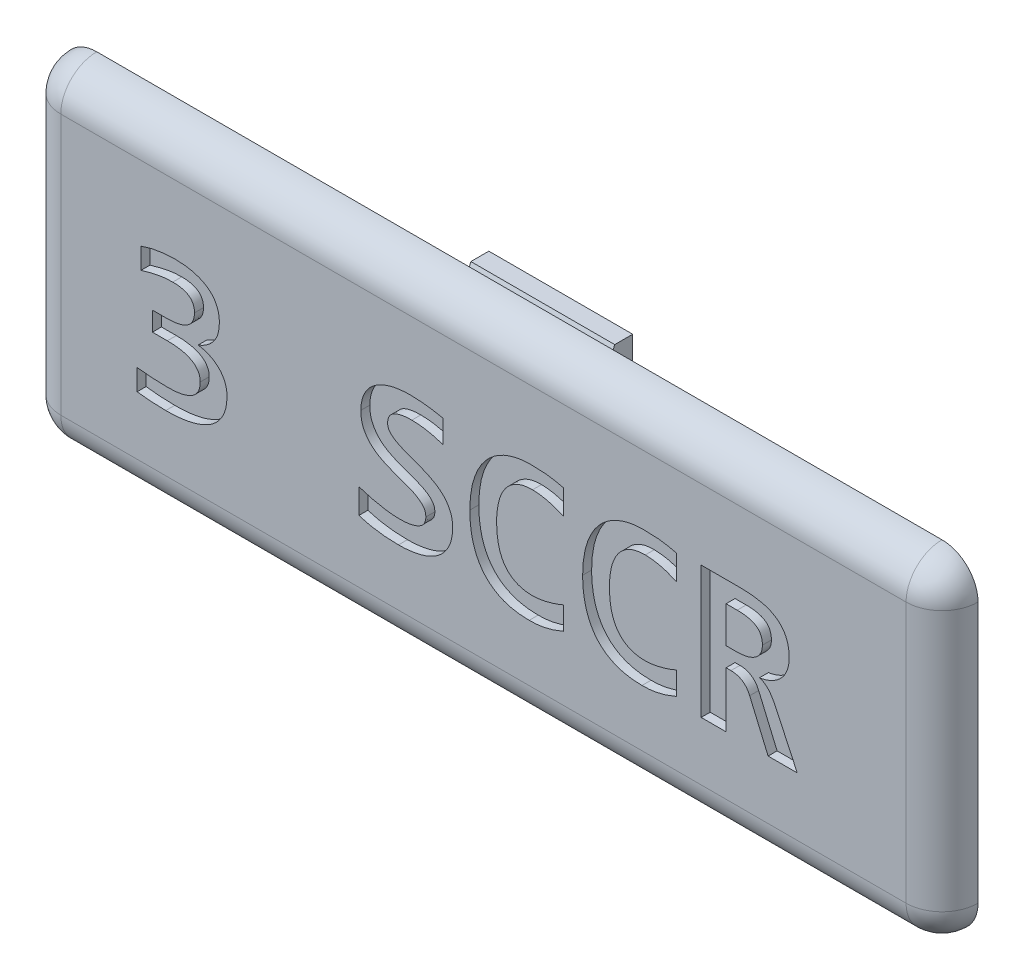
from build123d import *

# Parameters (mm, degrees)
BOSS_EXTRUDE1_DEPTH = 2
SKETCH3_W           = 47.5
SKETCH3_H           = 15
BOSS_EXTRUDE2_DEPTH = 1
SKETCH4_W           = 9.5
SKETCH4_H           = 5
CUT_EXTRUDE1_DEPTH  = 1
SKETCH5_W           = 8
SKETCH5_H           = 8.5
CUT_EXTRUDE2_DEPTH  = 1
SKETCH6_W           = 4
SKETCH6_H           = 1.75
BOSS_EXTRUDE3_DEPTH = 1.75
BOSS_EXTRUDE4_DEPTH = 4
FILLET1_R           = 2
CUT_EXTRUDE3_DEPTH  = 0.5


with BuildPart() as part:
    # Sketch1 → Boss-Extrude1 (new body)
    with BuildSketch(Plane.XY):
        with BuildLine():
            Line((25.5, -7.25), (25.5, 7.25))
            ThreePointArc((25.5, 7.25), (24.914213562, 8.664213562), (23.5, 9.25))
            Line((23.5, 9.25), (-23.5, 9.25))
            ThreePointArc((-23.5, 9.25), (-24.914213562, 8.664213562), (-25.5, 7.25))
            Line((-25.5, 7.25), (-25.5, -7.25))
            ThreePointArc((-25.5, -7.25), (-24.914213562, -8.664213562), (-23.5, -9.25))
            Line((-23.5, -9.25), (23.5, -9.25))
            ThreePointArc((23.5, -9.25), (24.914213562, -8.664213562), (25.5, -7.25))
        make_face()
    extrude(amount=BOSS_EXTRUDE1_DEPTH)

    # Sketch3 → Boss-Extrude2 (add)
    with BuildSketch(Plane(origin=(0, 0, 0), x_dir=(-1, 0, 0), z_dir=(0, 0, -1))):
        Rectangle(SKETCH3_W, SKETCH3_H)
    extrude(amount=BOSS_EXTRUDE2_DEPTH)

    # Sketch4 → Cut-Extrude1 (cut)
    with BuildSketch(Plane(origin=(0, 0, -1), x_dir=(-1, 0, 0), z_dir=(0, 0, -1))):
        with Locations((-13.5, -5)):
            Rectangle(SKETCH4_W, SKETCH4_H)
    extrude(amount=-CUT_EXTRUDE1_DEPTH, mode=Mode.SUBTRACT)

    # Sketch5 → Cut-Extrude2 (cut)
    with BuildSketch(Plane(origin=(0, 0, -1), x_dir=(-1, 0, 0), z_dir=(0, 0, -1))):
        with Locations((-17, 3.5)):
            Rectangle(SKETCH5_W, SKETCH5_H)
    extrude(amount=-CUT_EXTRUDE2_DEPTH, mode=Mode.SUBTRACT)

    # Sketch6 → Boss-Extrude3 (add)
    with BuildSketch(Plane(origin=(0, 0, 0), x_dir=(-1, 0, 0), z_dir=(0, 0, -1))):
        with Locations((-13.5, -8.375)):
            Rectangle(SKETCH6_W, SKETCH6_H)
    extrude(amount=BOSS_EXTRUDE3_DEPTH)

    # Sketch8 → Boss-Extrude4 (add, symmetric)
    with BuildSketch(Plane(origin=(0, 0, 0), x_dir=(0, 0, -1), z_dir=(1, 0, 0))):
        Polygon((2.3, 6.05), (2.3, 8.25), (1.3, 8.25), (1, 7.5), (1, 5.25), align=None)
    boss_extrude4 = extrude(amount=BOSS_EXTRUDE4_DEPTH, both=True)

    # Mirror1: Boss-Extrude4 across plane
    add(boss_extrude4.mirror(Plane.ZX))

    # Fillet1
    fillet1_edges = [part.edges().sort_by_distance(p)[0] for p in [
        (-24.914213562, 8.664213562, 2),
        (0, 9.25, 2),
        (24.914213562, 8.664213562, 2),
        (25.5, 0, 2),
        (24.914213562, -8.664213562, 2),
        (0, -9.25, 2),
        (-24.914213562, -8.664213562, 2),
        (-25.5, 0, 2),
    ]]
    fillet(fillet1_edges, radius=FILLET1_R - 0.0001)  # a hair under: the kernel refuses the full size

    # Sketch9 → Cut-Extrude3 (cut)
    # profile 1 of 5: a face of its own
    with BuildSketch(Plane.XY.offset(2)):
        with BuildLine():
            add(Edge.make_bspline(
                [(-14.258793308, -1.734083933), (-14.261338893, -1.823383609), (-14.266327739, -1.998393475), (-14.305698368, -2.25394343), (-14.367829681, -2.496289664), (-14.458272629, -2.724000008), (-14.574973019, -2.936439813), (-14.719678085, -3.132982857), (-14.891993388, -3.312795027), (-15.09094383, -3.476300858), (-15.317316464, -3.621669421), (-15.571568157, -3.746944082), (-15.852002593, -3.857030086), (-16.159955894, -3.947723529), (-16.495450504, -4.018804737), (-16.85903025, -4.069328029), (-17.251191763, -4.101550311), (-17.522487334, -4.104694309), (-17.662651095, -4.106318642)],
                knots=[0, 0, 0, 0, 0.912858116, 1.789023019, 2.637878569, 3.466527431, 4.287731762, 5.110028795, 5.955173898, 6.828167036, 7.737664031, 8.700030571, 9.722187227, 10.815149218, 11.979155375, 13.226095558, 14.56687347, 16, 16, 16, 16], degree=3))
            add(Edge.make_bspline(
                [(-17.662651095, -4.106318642), (-17.728552119, -4.106106072), (-17.863709896, -4.105670108), (-18.069167207, -4.098459142), (-18.278995596, -4.088109784), (-18.488413845, -4.077387031), (-18.694888198, -4.061628202), (-18.893811258, -4.045969345), (-19.080754001, -4.027306556), (-19.199353248, -4.008802269), (-19.255769503, -4)],
                knots=[0, 0, 0, 0, 0.98977331, 2.029946609, 3.087400155, 4.145278822, 5.179315745, 6.197408451, 7.142528593, 8, 8, 8, 8], degree=3))
            Line((-19.255769503, -4), (-19.255769503, -2.830494933))
            add(Edge.make_bspline(
                [(-19.255769503, -2.830494933), (-19.130135895, -2.844969323), (-18.864841823, -2.875534153), (-18.448360506, -2.910154596), (-18.001204384, -2.931420699), (-17.694237415, -2.93499503), (-17.538058936, -2.936813576)],
                knots=[0, 0, 0, 0, 0.881238994, 1.860867368, 2.911653319, 4, 4, 4, 4], degree=3))
            add(Edge.make_bspline(
                [(-17.538058936, -2.936813576), (-17.462713414, -2.936001075), (-17.317401653, -2.934434081), (-17.107962404, -2.918480834), (-16.914456114, -2.89726473), (-16.737354578, -2.860823198), (-16.574423102, -2.819674898), (-16.427616645, -2.764773178), (-16.293722073, -2.706956773), (-16.175854778, -2.635929602), (-16.073009548, -2.556405953), (-15.983156988, -2.468871223), (-15.907516922, -2.372843473), (-15.84985443, -2.265755706), (-15.802219469, -2.153234027), (-15.771726618, -2.031571755), (-15.750825675, -1.904253033), (-15.748455611, -1.81668007), (-15.747254303, -1.772292195)],
                knots=[0, 0, 0, 0, 1.495058618, 2.883377717, 4.167516066, 5.355141025, 6.469461815, 7.498576906, 8.462730458, 9.359913735, 10.221662372, 11.037695279, 11.844498768, 12.636570746, 13.444795257, 14.263193053, 15.119669287, 16, 16, 16, 16], degree=3))
            add(Edge.make_bspline(
                [(-15.747254303, -1.772292195), (-15.748521714, -1.73289899), (-15.751019789, -1.655254771), (-15.771160692, -1.541113562), (-15.806313248, -1.432907933), (-15.854778537, -1.330608247), (-15.917022957, -1.235314035), (-15.99202848, -1.146150588), (-16.083429854, -1.066182151), (-16.188882129, -0.992952537), (-16.308600244, -0.926912568), (-16.443475503, -0.867803366), (-16.594047931, -0.819448653), (-16.759893249, -0.777456271), (-16.940920038, -0.745178208), (-17.138152139, -0.719295647), (-17.351855094, -0.707423753), (-17.499841856, -0.705246494), (-17.576267198, -0.704122084)],
                knots=[0, 0, 0, 0, 0.79719744, 1.571280462, 2.337038891, 3.094215274, 3.856024772, 4.635446918, 5.445390317, 6.306838918, 7.230180381, 8.209082667, 9.28323138, 10.427896051, 11.670224082, 13.003691142, 14.452605309, 16, 16, 16, 16], degree=3))
            Line((-17.576267198, -0.704122084), (-18.405220363, -0.704122084))
            Line((-18.405220363, -0.704122084), (-18.405220363, 0.35906434))
            Line((-18.405220363, 0.35906434), (-17.629426519, 0.35906434))
            add(Edge.make_bspline(
                [(-17.629426519, 0.35906434), (-17.55683698, 0.359705028), (-17.417540212, 0.360934486), (-17.218619488, 0.378860112), (-17.038269223, 0.401572984), (-16.877568096, 0.439206214), (-16.733398524, 0.483455606), (-16.606062681, 0.536879816), (-16.492503018, 0.594408261), (-16.395530458, 0.661780928), (-16.31148418, 0.734999634), (-16.240932279, 0.815344734), (-16.183901556, 0.902122176), (-16.126882849, 1.026052013), (-16.075630298, 1.190817292), (-16.069362116, 1.328233905), (-16.06621023, 1.397332332)],
                knots=[0, 0, 0, 0, 1.433789909, 2.751392296, 3.944481829, 5.022152935, 6.008459802, 6.920862344, 7.747986091, 8.518918421, 9.247697909, 9.945594126, 10.625414262, 11.291085687, 12.637852341, 14, 14, 14, 14], degree=3))
            add(Edge.make_bspline(
                [(-16.06621023, 1.397332332), (-16.06938206, 1.464724995), (-16.075452106, 1.593696778), (-16.130987146, 1.775229574), (-16.227256232, 1.929653537), (-16.337443936, 2.034583651), (-16.44152632, 2.103851658), (-16.531375424, 2.149343865), (-16.630765633, 2.186639405), (-16.740076529, 2.218725289), (-16.859606443, 2.242926192), (-16.989345443, 2.261515383), (-17.12925561, 2.270915135), (-17.225736326, 2.272157839), (-17.275584788, 2.272799904)],
                knots=[0, 0, 0, 0, 1.426007585, 2.729002435, 3.973101892, 5.243117734, 5.92019915, 6.618316047, 7.372490256, 8.167305632, 9.030498267, 9.955026394, 10.943428355, 12, 12, 12, 12], degree=3))
            add(Edge.make_bspline(
                [(-17.275584788, 2.272799904), (-17.422615064, 2.268967212), (-17.716518884, 2.261305915), (-18.155353483, 2.188768052), (-18.597751135, 2.086084968), (-18.892376544, 1.998605823), (-19.043132218, 1.953843976)],
                knots=[0, 0, 0, 0, 0.977921989, 1.954801514, 2.953500725, 4, 4, 4, 4], degree=3))
            Line((-19.043132218, 1.953843976), (-19.043132218, 3.123349043))
            add(Edge.make_bspline(
                [(-19.043132218, 3.123349043), (-18.960851984, 3.150658191), (-18.801677238, 3.203488943), (-18.563774197, 3.269155245), (-18.331267157, 3.322049004), (-18.099876362, 3.367572929), (-17.867168774, 3.402868419), (-17.63092575, 3.42584622), (-17.389810563, 3.439096806), (-17.226871855, 3.441226392), (-17.144347713, 3.442304971)],
                knots=[0, 0, 0, 0, 1.075346247, 2.080304799, 3.060132735, 4.03283104, 5.005311009, 5.978664027, 6.976246853, 8, 8, 8, 8], degree=3))
            add(Edge.make_bspline(
                [(-17.144347713, 3.442304971), (-17.046289385, 3.440652827), (-16.855977069, 3.437446335), (-16.580105814, 3.414445776), (-16.322848561, 3.37532172), (-16.084480329, 3.317998641), (-15.863586537, 3.249326378), (-15.660322405, 3.165981418), (-15.476369959, 3.068242562), (-15.309890796, 2.958232233), (-15.162780235, 2.834496369), (-15.033492344, 2.698503567), (-14.92642265, 2.546707518), (-14.838861988, 2.383453163), (-14.767605335, 2.210206722), (-14.720796824, 2.025542998), (-14.689321723, 1.831990145), (-14.685842204, 1.699252871), (-14.684067878, 1.631565592)],
                knots=[0, 0, 0, 0, 1.364469515, 2.64817236, 3.849188922, 4.981835705, 6.056593623, 7.065464157, 8.034128668, 8.950988563, 9.836987269, 10.703777712, 11.55477087, 12.413301389, 13.277587792, 14.154187413, 15.058756973, 16, 16, 16, 16], degree=3))
            add(Edge.make_bspline(
                [(-14.684067878, 1.631565592), (-14.684879263, 1.577801039), (-14.686455192, 1.473375719), (-14.702940769, 1.320442682), (-14.723975407, 1.174911104), (-14.760694342, 1.037819713), (-14.802244553, 0.908117448), (-14.857154141, 0.78701381), (-14.918795464, 0.672534743), (-15.018360905, 0.532359573), (-15.162206805, 0.371387678), (-15.367132869, 0.204259936), (-15.600704282, 0.057268361), (-15.7742726, -0.015496691), (-15.863540318, -0.0529204)],
                knots=[0, 0, 0, 0, 0.875870592, 1.701177886, 2.505390449, 3.26934707, 4.011398404, 4.722507864, 5.433445482, 6.126983947, 7.520330249, 8.937068978, 10.424707544, 12, 12, 12, 12], degree=3))
            add(Edge.make_bspline(
                [(-15.863540318, -0.0529204), (-15.804132402, -0.063217709), (-15.687276695, -0.083472575), (-15.517203964, -0.126764063), (-15.356129467, -0.181300381), (-15.204687775, -0.24712644), (-15.060796757, -0.318537761), (-14.929892491, -0.4047823), (-14.806842634, -0.497576179), (-14.696222701, -0.602398035), (-14.596054123, -0.71573569), (-14.507343206, -0.837090062), (-14.432561063, -0.967852328), (-14.369396552, -1.105602099), (-14.318605458, -1.251092974), (-14.284670315, -1.405031158), (-14.261898494, -1.566726019), (-14.259842802, -1.677520134), (-14.258793308, -1.734083933)],
                knots=[0, 0, 0, 0, 1.131854241, 2.226363734, 3.291739802, 4.321193935, 5.325664044, 6.303407478, 7.260079633, 8.216356155, 9.159311667, 10.097323885, 11.033663294, 11.982847151, 12.93974531, 13.920965814, 14.938589176, 16, 16, 16, 16], degree=3))
        make_face()
    # profile 2 of 5: a face of its own
    with BuildSketch(Plane.XY.offset(2)):
        with BuildLine():
            add(Edge.make_bspline(
                [(-1.713193501, -1.772292195), (-1.715233027, -1.86883922), (-1.719193694, -2.056329111), (-1.76456463, -2.327452066), (-1.832762425, -2.580211484), (-1.931851129, -2.812595013), (-2.055559882, -3.024552799), (-2.201396602, -3.217804638), (-2.369960467, -3.391303509), (-2.561057485, -3.544437546), (-2.771652397, -3.679455981), (-3.001453676, -3.795948339), (-3.251311274, -3.891826562), (-3.517936509, -3.971067083), (-3.800658831, -4.032295381), (-4.097155575, -4.074474411), (-4.406621897, -4.102272544), (-4.617512739, -4.104952633), (-4.725001294, -4.106318642)],
                knots=[0, 0, 0, 0, 1.073681499, 2.085040185, 3.051149047, 3.981944283, 4.887978953, 5.776845786, 6.670466122, 7.573455289, 8.49677068, 9.450589821, 10.436166866, 11.471749255, 12.544173733, 13.653021529, 14.803772988, 16, 16, 16, 16], degree=3))
            add(Edge.make_bspline(
                [(-4.725001294, -4.106318642), (-4.915614486, -4.102798045), (-5.291554785, -4.095854484), (-5.847807662, -4.040981544), (-6.39253871, -3.942410694), (-6.745288718, -3.83926823), (-6.92280698, -3.787362715)],
                knots=[0, 0, 0, 0, 1.025764599, 2.023082686, 3.005134181, 4, 4, 4, 4], degree=3))
            Line((-6.92280698, -3.787362715), (-6.92280698, -2.405220363))
            add(Edge.make_bspline(
                [(-6.92280698, -2.405220363), (-6.833194946, -2.433752405), (-6.651247326, -2.491683655), (-6.373987719, -2.573947282), (-6.089179773, -2.643700599), (-5.802658794, -2.707893455), (-5.515483022, -2.758875756), (-5.230310999, -2.799365289), (-4.949748281, -2.825427735), (-4.764369425, -2.828828163), (-4.673503201, -2.830494933)],
                knots=[0, 0, 0, 0, 0.982138956, 1.994127776, 3.019379675, 4.043652595, 5.060010385, 6.064286964, 7.051181246, 8, 8, 8, 8], degree=3))
            add(Edge.make_bspline(
                [(-4.673503201, -2.830494933), (-4.60925134, -2.830041177), (-4.486167432, -2.82917194), (-4.308685604, -2.817522363), (-4.146813448, -2.797713359), (-3.99841215, -2.771659209), (-3.864938101, -2.736600061), (-3.74354992, -2.697026889), (-3.63584851, -2.650592558), (-3.539569694, -2.599216546), (-3.457062112, -2.541104792), (-3.385200234, -2.479147037), (-3.326842052, -2.41049185), (-3.264639214, -2.31293006), (-3.212644507, -2.175714647), (-3.205354658, -2.060183021), (-3.201654495, -2.001541768)],
                knots=[0, 0, 0, 0, 1.428616996, 2.73672639, 3.952495327, 5.053878092, 6.0842745, 7.018828766, 7.890331589, 8.689308687, 9.440856164, 10.130100935, 10.793906804, 11.436117796, 12.698631087, 14, 14, 14, 14], degree=3))
            add(Edge.make_bspline(
                [(-3.201654495, -2.001541768), (-3.203654865, -1.958771597), (-3.207546134, -1.875571834), (-3.235337867, -1.755432625), (-3.286848579, -1.647416226), (-3.356182013, -1.550251705), (-3.441638553, -1.462276945), (-3.536744971, -1.376740422), (-3.648540437, -1.301439577), (-3.813457809, -1.201559554), (-4.046762146, -1.089822564), (-4.353324012, -0.977026591), (-4.677987751, -0.863142475), (-5.011825054, -0.742734921), (-5.344079319, -0.604190817), (-5.618909124, -0.480251865), (-5.830295789, -0.36590432), (-5.979520777, -0.26961421), (-6.120127413, -0.163700793), (-6.253528902, -0.050172024), (-6.375319735, 0.076312692), (-6.483114552, 0.215194346), (-6.580596385, 0.364229564), (-6.665806043, 0.5253021), (-6.735490144, 0.701900771), (-6.782405313, 0.895267416), (-6.810964062, 1.105210511), (-6.814600779, 1.25049351), (-6.816488338, 1.325899495)],
                knots=[0, 0, 0, 0, 0.628577789, 1.222756944, 1.798018064, 2.376093337, 2.969100815, 3.597678604, 4.252424917, 4.946124793, 6.431204757, 8.043936516, 9.745465074, 11.488681512, 13.25853968, 15.035457213, 15.916880054, 16.788288763, 17.642849837, 18.502665518, 19.360321436, 20.218324825, 21.082903639, 21.974822425, 22.892221362, 23.865363472, 24.892063288, 26, 26, 26, 26], degree=3))
            add(Edge.make_bspline(
                [(-6.816488338, 1.325899495), (-6.814677983, 1.396899448), (-6.81109741, 1.537325268), (-6.779301757, 1.744578619), (-6.732185213, 1.94709667), (-6.661993259, 2.142380693), (-6.572896903, 2.330295573), (-6.45836874, 2.505213834), (-6.32339806, 2.669490324), (-6.163880377, 2.819446715), (-5.981962022, 2.956357854), (-5.775612689, 3.077128365), (-5.547240693, 3.186132933), (-5.293180526, 3.27637227), (-5.014319785, 3.352603328), (-4.707642475, 3.403362452), (-4.374177679, 3.438208093), (-4.142563975, 3.44090476), (-4.022301516, 3.442304971)],
                knots=[0, 0, 0, 0, 0.86106195, 1.703033948, 2.539139973, 3.380790137, 4.216301896, 5.056905248, 5.911254958, 6.790607679, 7.707171391, 8.668295362, 9.687250551, 10.773449095, 11.935660323, 13.190638171, 14.54127474, 16, 16, 16, 16], degree=3))
            add(Edge.make_bspline(
                [(-4.022301516, 3.442304971), (-3.947526177, 3.441212585), (-3.794545853, 3.438977711), (-3.562482704, 3.424728832), (-3.3269951, 3.405528791), (-3.093355447, 3.37840904), (-2.865021743, 3.347628146), (-2.645999032, 3.310337834), (-2.439472029, 3.273976103), (-2.307811674, 3.244011532), (-2.244786713, 3.229667686)],
                knots=[0, 0, 0, 0, 1.000632186, 2.047159369, 3.110551158, 4.162103459, 5.194366354, 6.193323381, 7.135155576, 8, 8, 8, 8], degree=3))
            Line((-2.244786713, 3.229667686), (-2.244786713, 1.953843976))
            add(Edge.make_bspline(
                [(-2.244786713, 1.953843976), (-2.307699226, 1.976638887), (-2.437996654, 2.02384918), (-2.64237069, 2.083612661), (-2.858228133, 2.139088539), (-3.082399583, 2.184375354), (-3.311096004, 2.223247434), (-3.539547555, 2.250317419), (-3.76279106, 2.270577425), (-3.909294908, 2.27207115), (-3.980770797, 2.272799904)],
                knots=[0, 0, 0, 0, 0.905300762, 1.874958649, 2.879989676, 3.920459461, 4.968805495, 6.018141936, 7.033096622, 8, 8, 8, 8], degree=3))
            add(Edge.make_bspline(
                [(-3.980770797, 2.272799904), (-4.039494833, 2.272389091), (-4.152639542, 2.27159757), (-4.31501932, 2.259293716), (-4.463951016, 2.242252446), (-4.598430671, 2.214824371), (-4.72093559, 2.184100685), (-4.830644173, 2.145519451), (-4.930089415, 2.10263298), (-5.017746418, 2.052694949), (-5.095715439, 1.998747048), (-5.159385349, 1.934970283), (-5.21504554, 1.868264099), (-5.26993136, 1.768647923), (-5.318691272, 1.631342363), (-5.324855855, 1.515217838), (-5.328027344, 1.45547534)],
                knots=[0, 0, 0, 0, 1.388230333, 2.674729552, 3.848979118, 4.930101904, 5.917823404, 6.833012122, 7.677256906, 8.474713018, 9.216010271, 9.910495862, 10.599653, 11.262301414, 12.591538262, 14, 14, 14, 14], degree=3))
            add(Edge.make_bspline(
                [(-5.328027344, 1.45547534), (-5.326140309, 1.418174266), (-5.322476867, 1.345758875), (-5.292841221, 1.241254428), (-5.244216499, 1.14496574), (-5.174135585, 1.058742341), (-5.0895785, 0.979081521), (-4.993264051, 0.902275726), (-4.882776874, 0.83164487), (-4.716935667, 0.738595927), (-4.483141394, 0.633682813), (-4.179215829, 0.515750977), (-3.852427598, 0.403089781), (-3.51888139, 0.274869482), (-3.183158369, 0.138552943), (-2.911012928, 0.005444147), (-2.699270575, -0.110275923), (-2.550153937, -0.208418222), (-2.40942641, -0.315837742), (-2.277071103, -0.431003405), (-2.154457389, -0.556327431), (-2.044300439, -0.692798283), (-1.948190949, -0.841233473), (-1.86402334, -1.000219255), (-1.795019176, -1.171685328), (-1.746923831, -1.358660404), (-1.718929065, -1.560463106), (-1.715145096, -1.700214789), (-1.713193501, -1.772292195)],
                knots=[0, 0, 0, 0, 0.557156268, 1.081649532, 1.611348813, 2.159818371, 2.733894156, 3.347031838, 3.999468898, 4.692937397, 6.19005387, 7.82657883, 9.568786128, 11.359307707, 13.171290529, 14.986394118, 15.88741221, 16.778746798, 17.653416553, 18.53387112, 19.400741367, 20.27258301, 21.152453011, 22.041629961, 22.959843454, 23.910073311, 24.922113205, 26, 26, 26, 26], degree=3))
        make_face()
    # profile 3 of 5: a face of its own
    with BuildSketch(Plane.XY.offset(2)):
        with BuildLine():
            add(Edge.make_bspline(
                [(4.45328776, -3.681044073), (4.372217974, -3.715651713), (4.213161544, -3.78355084), (3.972748056, -3.869639406), (3.736722457, -3.943199485), (3.502831276, -4.003376747), (3.268503599, -4.051305953), (3.030754934, -4.081278545), (2.788575749, -4.102804536), (2.625431912, -4.105137879), (2.542874654, -4.106318642)],
                knots=[0, 0, 0, 0, 1.072602722, 2.104413604, 3.106297595, 4.08050826, 5.042709706, 6.014913564, 6.995467464, 8, 8, 8, 8], degree=3))
            add(Edge.make_bspline(
                [(2.542874654, -4.106318642), (2.413728184, -4.103492024), (2.162983726, -4.098004001), (1.79763062, -4.05421812), (1.455509278, -3.981881344), (1.135407943, -3.880896975), (0.839698664, -3.74894936), (0.566976326, -3.588758587), (0.317755098, -3.400288826), (0.093762938, -3.182517542), (-0.105393212, -2.936959921), (-0.276462504, -2.661403863), (-0.424786984, -2.360128288), (-0.545975999, -2.030430302), (-0.640277326, -1.673279527), (-0.707095612, -1.288682645), (-0.749812595, -0.876744797), (-0.754110337, -0.592930873), (-0.756325719, -0.446631622)],
                knots=[0, 0, 0, 0, 1.102605573, 2.140764961, 3.136846793, 4.08496906, 5.001529512, 5.896051515, 6.780328523, 7.66316301, 8.557497515, 9.473264751, 10.427030373, 11.420482266, 12.467702166, 13.577100782, 14.751053738, 16, 16, 16, 16], degree=3))
            add(Edge.make_bspline(
                [(-0.756325719, -0.446631622), (-0.753667796, -0.296438203), (-0.748486532, -0.003656335), (-0.702160165, 0.422129627), (-0.631194587, 0.823413824), (-0.525440088, 1.197531333), (-0.395354931, 1.546322967), (-0.23652584, 1.866121809), (-0.055632105, 2.159862228), (0.153437343, 2.423544911), (0.386576277, 2.659138786), (0.644713649, 2.864478875), (0.924700837, 3.042084351), (1.22970337, 3.18668041), (1.555545965, 3.300804906), (1.901435568, 3.384664843), (2.267413645, 3.432723431), (2.517816106, 3.439062962), (2.645870839, 3.442304971)],
                knots=[0, 0, 0, 0, 1.232307787, 2.402218284, 3.511138658, 4.573037126, 5.588482404, 6.562047137, 7.499038646, 8.414657469, 9.317692522, 10.213424542, 11.116219401, 12.033010505, 12.977368732, 13.94518829, 14.949178196, 16, 16, 16, 16], degree=3))
            add(Edge.make_bspline(
                [(2.645870839, 3.442304971), (2.727839596, 3.442379303), (2.886840555, 3.442523492), (3.119358272, 3.432355728), (3.342375572, 3.423315248), (3.560391528, 3.399418422), (3.778025589, 3.373138858), (3.997853534, 3.33205503), (4.224403065, 3.289945185), (4.375983186, 3.250026087), (4.45328776, 3.229667686)],
                knots=[0, 0, 0, 0, 1.077376558, 2.089868288, 3.059369192, 4.010411707, 4.972009834, 5.940198088, 6.949518525, 8, 8, 8, 8], degree=3))
            Line((4.45328776, 3.229667686), (4.45328776, 1.847525334))
            add(Edge.make_bspline(
                [(4.45328776, 1.847525334), (4.373946173, 1.883908699), (4.218583533, 1.955152746), (3.983416207, 2.04394639), (3.755143128, 2.120277488), (3.53189074, 2.175420359), (3.318020652, 2.21935258), (3.112736965, 2.248995054), (2.917569989, 2.268267408), (2.7904383, 2.271322067), (2.728932278, 2.272799904)],
                knots=[0, 0, 0, 0, 1.170030163, 2.291093263, 3.368831198, 4.395296508, 5.372370687, 6.295361994, 7.175300008, 8, 8, 8, 8], degree=3))
            add(Edge.make_bspline(
                [(2.728932278, 2.272799904), (2.643533004, 2.27071407), (2.478614608, 2.266686021), (2.240437809, 2.231648306), (2.021545776, 2.172374666), (1.822203654, 2.08841263), (1.640760132, 1.984052988), (1.475143446, 1.861337692), (1.328315735, 1.716704966), (1.198336054, 1.554716953), (1.084692277, 1.375038531), (0.987167081, 1.178986948), (0.905265096, 0.966562601), (0.841699666, 0.738750149), (0.791830967, 0.497822889), (0.757970043, 0.244643479), (0.735263199, -0.019834089), (0.733191739, -0.200166262), (0.732135275, -0.292137345)],
                knots=[0, 0, 0, 0, 1.109729706, 2.143049175, 3.121026665, 4.050204485, 4.946654748, 5.836403406, 6.722153568, 7.618170183, 8.530804457, 9.480502004, 10.460411604, 11.48580219, 12.551706219, 13.656287425, 14.804684813, 16, 16, 16, 16], degree=3))
            add(Edge.make_bspline(
                [(0.732135275, -0.292137345), (0.732967869, -0.389108251), (0.734592834, -0.578365433), (0.760041659, -0.853722278), (0.792682067, -1.114433872), (0.844523514, -1.35809311), (0.909855882, -1.585438087), (0.99385864, -1.794112454), (1.09109911, -1.986543156), (1.206539657, -2.160422771), (1.337983831, -2.316818706), (1.488654779, -2.451462953), (1.655337671, -2.5676376), (1.838994972, -2.664747876), (2.041365823, -2.739263874), (2.261119877, -2.791527194), (2.498028958, -2.826230809), (2.662352053, -2.829042844), (2.747205795, -2.830494933)],
                knots=[0, 0, 0, 0, 1.256876421, 2.453033611, 3.583260076, 4.661975506, 5.679853963, 6.646528144, 7.574590913, 8.470745685, 9.346915849, 10.216322401, 11.082788599, 11.975686973, 12.902638023, 13.870910894, 14.900573425, 16, 16, 16, 16], degree=3))
            add(Edge.make_bspline(
                [(2.747205795, -2.830494933), (2.812631955, -2.828899674), (2.948967401, -2.825575464), (3.159104265, -2.796657186), (3.377766428, -2.755402575), (3.601336587, -2.704040956), (3.824130367, -2.641187625), (4.043316784, -2.568293444), (4.253261032, -2.489921555), (4.38813096, -2.432810969), (4.45328776, -2.405220363)],
                knots=[0, 0, 0, 0, 0.887372101, 1.849111607, 2.873273884, 3.906654629, 4.960374994, 6.012916101, 7.040022999, 8, 8, 8, 8], degree=3))
            Line((4.45328776, -2.405220363), (4.45328776, -3.681044073))
        make_face()
    # profile 4 of 5: a face of its own
    with BuildSketch(Plane.XY.offset(2)):
        with BuildLine():
            add(Edge.make_bspline(
                [(10.726087664, -3.681044073), (10.645017878, -3.715651713), (10.485961448, -3.78355084), (10.24554796, -3.869639406), (10.009522361, -3.943199485), (9.77563118, -4.003376747), (9.541303503, -4.051305953), (9.303554838, -4.081278545), (9.061375653, -4.102804536), (8.898231816, -4.105137879), (8.815674558, -4.106318642)],
                knots=[0, 0, 0, 0, 1.072602722, 2.104413604, 3.106297595, 4.08050826, 5.042709706, 6.014913564, 6.995467464, 8, 8, 8, 8], degree=3))
            add(Edge.make_bspline(
                [(8.815674558, -4.106318642), (8.686528088, -4.103492024), (8.435783629, -4.098004001), (8.070430524, -4.05421812), (7.728309182, -3.981881344), (7.408207847, -3.880896975), (7.112498568, -3.74894936), (6.83977623, -3.588758587), (6.590555002, -3.400288826), (6.366562841, -3.182517542), (6.167406691, -2.936959921), (5.996337399, -2.661403863), (5.84801292, -2.360128288), (5.726823905, -2.030430302), (5.632522578, -1.673279527), (5.565704292, -1.288682645), (5.522987308, -0.876744797), (5.518689567, -0.592930873), (5.516474185, -0.446631622)],
                knots=[0, 0, 0, 0, 1.102605573, 2.140764961, 3.136846793, 4.08496906, 5.001529512, 5.896051515, 6.780328523, 7.66316301, 8.557497515, 9.473264751, 10.427030373, 11.420482266, 12.467702166, 13.577100782, 14.751053738, 16, 16, 16, 16], degree=3))
            add(Edge.make_bspline(
                [(5.516474185, -0.446631622), (5.519132108, -0.296438203), (5.524313372, -0.003656335), (5.570639739, 0.422129627), (5.641605317, 0.823413824), (5.747359816, 1.197531333), (5.877444973, 1.546322967), (6.036274064, 1.866121809), (6.217167799, 2.159862228), (6.426237247, 2.423544911), (6.659376181, 2.659138786), (6.917513553, 2.864478875), (7.19750074, 3.042084351), (7.502503274, 3.18668041), (7.828345869, 3.300804906), (8.174235472, 3.384664843), (8.540213549, 3.432723431), (8.79061601, 3.439062962), (8.918670743, 3.442304971)],
                knots=[0, 0, 0, 0, 1.232307787, 2.402218284, 3.511138658, 4.573037126, 5.588482404, 6.562047137, 7.499038646, 8.414657469, 9.317692522, 10.213424542, 11.116219401, 12.033010505, 12.977368732, 13.94518829, 14.949178196, 16, 16, 16, 16], degree=3))
            add(Edge.make_bspline(
                [(8.918670743, 3.442304971), (9.0006395, 3.442379303), (9.159640459, 3.442523492), (9.392158176, 3.432355728), (9.615175476, 3.423315248), (9.833191432, 3.399418422), (10.050825493, 3.373138858), (10.270653438, 3.33205503), (10.497202969, 3.289945185), (10.64878309, 3.250026087), (10.726087664, 3.229667686)],
                knots=[0, 0, 0, 0, 1.077376558, 2.089868288, 3.059369192, 4.010411707, 4.972009834, 5.940198088, 6.949518525, 8, 8, 8, 8], degree=3))
            Line((10.726087664, 3.229667686), (10.726087664, 1.847525334))
            add(Edge.make_bspline(
                [(10.726087664, 1.847525334), (10.646746077, 1.883908699), (10.491383437, 1.955152746), (10.256216111, 2.04394639), (10.027943032, 2.120277488), (9.804690643, 2.175420359), (9.590820555, 2.21935258), (9.385536869, 2.248995054), (9.190369893, 2.268267408), (9.063238204, 2.271322067), (9.001732182, 2.272799904)],
                knots=[0, 0, 0, 0, 1.170030163, 2.291093263, 3.368831198, 4.395296508, 5.372370687, 6.295361994, 7.175300008, 8, 8, 8, 8], degree=3))
            add(Edge.make_bspline(
                [(9.001732182, 2.272799904), (8.916332908, 2.27071407), (8.751414511, 2.266686021), (8.513237712, 2.231648306), (8.29434568, 2.172374666), (8.095003558, 2.08841263), (7.913560035, 1.984052988), (7.74794335, 1.861337692), (7.601115638, 1.716704966), (7.471135958, 1.554716953), (7.35749218, 1.375038531), (7.259966985, 1.178986948), (7.178065, 0.966562601), (7.11449957, 0.738750149), (7.064630871, 0.497822889), (7.030769947, 0.244643479), (7.008063103, -0.019834089), (7.005991643, -0.200166262), (7.004935179, -0.292137345)],
                knots=[0, 0, 0, 0, 1.109729706, 2.143049175, 3.121026665, 4.050204485, 4.946654748, 5.836403406, 6.722153568, 7.618170183, 8.530804457, 9.480502004, 10.460411604, 11.48580219, 12.551706219, 13.656287425, 14.804684813, 16, 16, 16, 16], degree=3))
            add(Edge.make_bspline(
                [(7.004935179, -0.292137345), (7.005767772, -0.389108251), (7.007392737, -0.578365433), (7.032841562, -0.853722278), (7.065481971, -1.114433872), (7.117323418, -1.35809311), (7.182655786, -1.585438087), (7.266658544, -1.794112454), (7.363899014, -1.986543156), (7.479339561, -2.160422771), (7.610783735, -2.316818706), (7.761454683, -2.451462953), (7.928137575, -2.5676376), (8.111794876, -2.664747876), (8.314165727, -2.739263874), (8.53391978, -2.791527194), (8.770828861, -2.826230809), (8.935151957, -2.829042844), (9.020005699, -2.830494933)],
                knots=[0, 0, 0, 0, 1.256876421, 2.453033611, 3.583260076, 4.661975506, 5.679853963, 6.646528144, 7.574590913, 8.470745685, 9.346915849, 10.216322401, 11.082788599, 11.975686973, 12.902638023, 13.870910894, 14.900573425, 16, 16, 16, 16], degree=3))
            add(Edge.make_bspline(
                [(9.020005699, -2.830494933), (9.085431859, -2.828899674), (9.221767305, -2.825575464), (9.431904169, -2.796657186), (9.650566332, -2.755402575), (9.874136491, -2.704040956), (10.096930271, -2.641187625), (10.316116688, -2.568293444), (10.526060936, -2.489921555), (10.660930864, -2.432810969), (10.726087664, -2.405220363)],
                knots=[0, 0, 0, 0, 0.887372101, 1.849111607, 2.873273884, 3.906654629, 4.960374994, 6.012916101, 7.040022999, 8, 8, 8, 8], degree=3))
            Line((10.726087664, -2.405220363), (10.726087664, -3.681044073))
        make_face()
    # profile 5 of 5: a face of its own
    with BuildSketch(Plane.XY.offset(2)):
        with BuildLine():
            Line((15.829382501, -4), (14.804404339, -1.606169316))
            add(Edge.make_bspline(
                [(14.804404339, -1.606169316), (14.779460599, -1.551560995), (14.73099014, -1.445446581), (14.632886218, -1.304923819), (14.520963779, -1.184858891), (14.392757541, -1.087875148), (14.252406254, -1.010820377), (14.099099547, -0.955020147), (13.933499481, -0.924044981), (13.81941853, -0.91922244), (13.76115266, -0.916759369)],
                knots=[0, 0, 0, 0, 1.07937985, 2.097441539, 3.071055259, 4.024539089, 4.97969058, 5.945096662, 6.95047571, 8, 8, 8, 8], degree=3))
            Line((13.76115266, -0.916759369), (13.490372368, -0.916759369))
            Line((13.490372368, -0.916759369), (13.490372368, -4))
            Line((13.490372368, -4), (12.108230016, -4))
            Line((12.108230016, -4), (12.108230016, 3.335986328))
            Line((12.108230016, 3.335986328), (14.284439728, 3.335986328))
            add(Edge.make_bspline(
                [(14.284439728, 3.335986328), (14.385239514, 3.334558203), (14.582024792, 3.33177016), (14.869980409, 3.314507122), (15.142571932, 3.280355035), (15.400931983, 3.23678202), (15.643439528, 3.177654578), (15.868859081, 3.102221807), (16.074566864, 3.006751373), (16.261789897, 2.895060751), (16.431256532, 2.767544518), (16.578817671, 2.619467952), (16.705857208, 2.453509044), (16.81364176, 2.269510715), (16.896644607, 2.064631188), (16.95620659, 1.839219269), (16.993302183, 1.592367778), (16.996980303, 1.420173449), (16.998887568, 1.330883181)],
                knots=[0, 0, 0, 0, 1.254438722, 2.448964256, 3.587437174, 4.671603447, 5.707801299, 6.690588177, 7.624750448, 8.524079809, 9.399245701, 10.256818247, 11.116851234, 11.993805779, 12.902354155, 13.858471343, 14.889524007, 16, 16, 16, 16], degree=3))
            add(Edge.make_bspline(
                [(16.998887568, 1.330883181), (16.997231778, 1.266027698), (16.994008135, 1.139761161), (16.970695717, 0.955512005), (16.93094301, 0.782490816), (16.875946919, 0.620678219), (16.807311099, 0.469971709), (16.726109827, 0.329818696), (16.630380446, 0.200963764), (16.522568296, 0.083327798), (16.403745256, -0.022866842), (16.276691913, -0.120584195), (16.139125063, -0.206491695), (15.992374519, -0.28066425), (15.839567405, -0.346219442), (15.679689722, -0.39844254), (15.51453445, -0.442650533), (15.401513756, -0.462940622), (15.344303695, -0.473211283)],
                knots=[0, 0, 0, 0, 1.155349972, 2.249340124, 3.302347646, 4.313193118, 5.288908417, 6.248327119, 7.193487508, 8.143168254, 9.086215168, 10.029416886, 10.995709606, 11.970826185, 12.956664107, 13.955010984, 14.964844911, 16, 16, 16, 16], degree=3))
            add(Edge.make_bspline(
                [(15.344303695, -0.473211283), (15.388663804, -0.484841723), (15.478919204, -0.5085051), (15.60591461, -0.576550257), (15.728056084, -0.665064066), (15.844231011, -0.779239962), (15.955945376, -0.920394957), (16.068387043, -1.087983483), (16.179339873, -1.285151384), (16.248281151, -1.428002511), (16.284559189, -1.503173132)],
                knots=[0, 0, 0, 0, 0.75991202, 1.546122521, 2.376404305, 3.261596413, 4.243343524, 5.3639781, 6.612881775, 8, 8, 8, 8], degree=3))
            Line((16.284559189, -1.503173132), (17.44908057, -4))
            Line((17.44908057, -4), (15.829382501, -4))
        make_face()
        with BuildLine():
            add(Edge.make_bspline(
                [(15.510426574, 1.18137259), (15.509631991, 1.223508343), (15.508088357, 1.305365345), (15.491568818, 1.423597864), (15.462832905, 1.532551577), (15.425475948, 1.632271234), (15.376062634, 1.723132937), (15.314652668, 1.803901015), (15.242708245, 1.876239609), (15.159258847, 1.938225642), (15.066359281, 1.993062483), (14.961867848, 2.039395757), (14.847043984, 2.079627461), (14.72052339, 2.110126311), (14.58354943, 2.135262873), (14.435419027, 2.152973554), (14.276337715, 2.165182299), (14.166517367, 2.166039962), (14.110010705, 2.166481261)],
                knots=[0, 0, 0, 0, 1.03221539, 2.00528173, 2.91708139, 3.789130794, 4.609038712, 5.442315575, 6.267597059, 7.100873922, 7.98300273, 8.906244241, 9.897686097, 10.9608414, 12.092146654, 13.309174969, 14.615470257, 16, 16, 16, 16], degree=3))
            Line((14.110010705, 2.166481261), (13.490372368, 2.166481261))
            Line((13.490372368, 2.166481261), (13.490372368, 0.146427055))
            Line((13.490372368, 0.146427055), (14.063496299, 0.146427055))
            add(Edge.make_bspline(
                [(14.063496299, 0.146427055), (14.167812384, 0.149398433), (14.367684411, 0.15509166), (14.609596621, 0.196674424), (14.786164293, 0.244407579), (14.904701134, 0.292562688), (15.015047858, 0.34469923), (15.115189573, 0.406651435), (15.205671928, 0.476024524), (15.283724779, 0.555191143), (15.353055308, 0.640002535), (15.40989794, 0.734005413), (15.454378741, 0.835799617), (15.48863851, 0.944131172), (15.506327137, 1.060632159), (15.509033549, 1.140343917), (15.510426574, 1.18137259)],
                knots=[0, 0, 0, 0, 2.184691281, 4.185918933, 5.126368008, 6.012027286, 6.863184627, 7.681184451, 8.47504028, 9.246354907, 10.005704987, 10.765941227, 11.540044168, 12.329221459, 13.140028664, 14, 14, 14, 14], degree=3))
        make_face(mode=Mode.SUBTRACT)
    extrude(amount=-CUT_EXTRUDE3_DEPTH, mode=Mode.SUBTRACT)


solid = part.part
